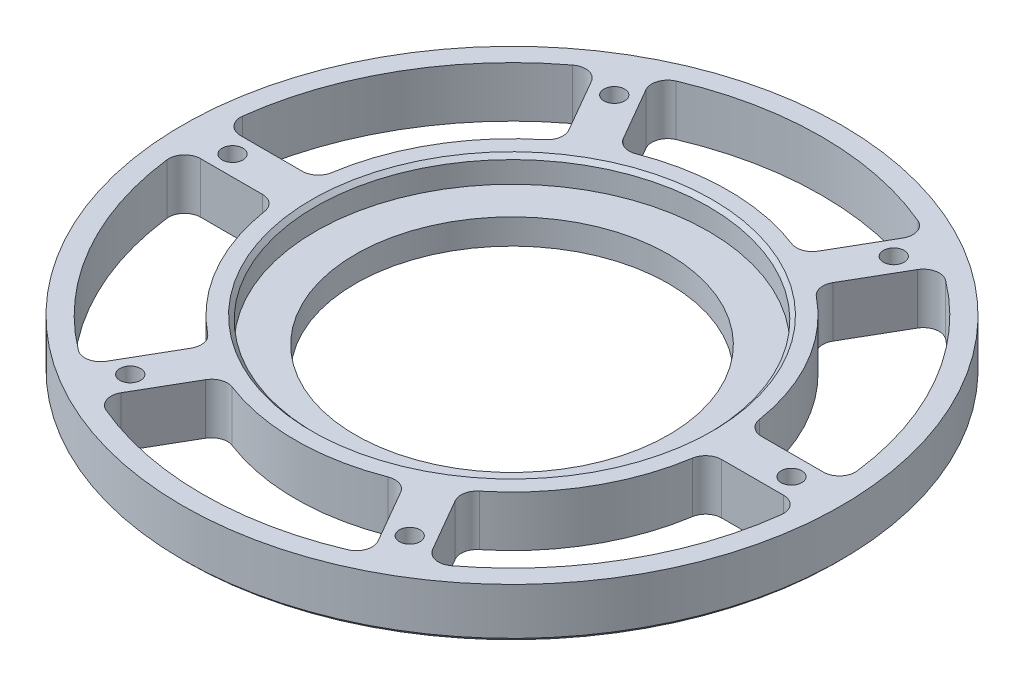
from build123d import *

# Parameters (mm, degrees)
F_6_0_204_DIAMETER_HOLE1_D = 5.1816
CIRPATTERN3_COUNT          = 6
CUT_EXTRUDE1_DEPTH         = 118.43208675655899
FILLET1_R                  = 4
CIRPATTERN4_COUNT          = 6
FILLET1_OF_CIRPATTERN4_R   = 4
CHAMFER1_SIZE              = 1
CHAMFER2_SIZE              = 1


with BuildPart() as part:
    # Sketch2 → Revolve1 (revolve)
    with BuildSketch(Plane(origin=(0, 0, 0), x_dir=(0, 0, -1), z_dir=(1, 0, 0))):
        Polygon((-39.2125, -8.7e-16), (-82.55, -5.31e-15), (-82.55, 12.699999999999994), (-49.2125, 12.699999999999994), (-49.21250000000001, 6.3500000000000005), (-39.21250000000001, 6.349999999999999), align=None)
    revolve(axis=Axis((0, -0.9525000000000071, 0), (0, 1, 0)))

    # #6 (0.204) Diameter Hole1 (through all)
    with Locations(Plane(origin=(0, 12.699999999999994, 0), x_dir=(1, 0, 0), z_dir=(0, 1, 0))):
        with Locations((-35, 60.621778265)):
            f_6_0_204_diameter_hole1 = Hole(F_6_0_204_DIAMETER_HOLE1_D / 2)

    # CirPattern3: #6 (0.204) Diameter Hole1 ×6 about axis
    cirpattern3_axis = Axis((0, -0.9525000000000071, 0), (0, 1, 0))
    for i in range(1, CIRPATTERN3_COUNT):
        add(f_6_0_204_diameter_hole1.rotate(cirpattern3_axis, i * 360 / CIRPATTERN3_COUNT), mode=Mode.SUBTRACT)

    # Sketch8 → Cut-Extrude1 (cut, through all)
    with BuildSketch(Plane(origin=(0, 12.699999999999994, 0), x_dir=(1, 0, 0), z_dir=(0, 1, 0))):
        with BuildLine():
            Line((-34.36419588509058, 69.52053323422601), (-22.660589701137393, 49.249292691841845))
            ThreePointArc((-22.660589701137393, 49.249292691841845), (3.32e-15, 54.212500000000006), (22.660589701137393, 49.249292691841845))
            Line((22.660589701137393, 49.249292691841845), (34.36419588509058, 69.52053323422601))
            ThreePointArc((34.36419588509058, 69.52053323422601), (4.75e-15, 77.55), (-34.36419588509058, 69.52053323422601))
        make_face()
    cut_extrude1 = extrude(amount=-CUT_EXTRUDE1_DEPTH, mode=Mode.SUBTRACT)

    # Fillet1
    fillet1_edges = [part.edges().sort_by_distance(p)[0] for p in [
        (34.36419588509058, 6.349999999999996, -69.52053323422601),
        (22.660589701137397, 6.349999999999996, -49.249292691841845),
        (-34.36419588509059, 6.349999999999996, -69.52053323422601),
        (-22.660589701137393, 6.349999999999996, -49.249292691841845),
    ]]
    fillet(fillet1_edges, radius=FILLET1_R)

    # CirPattern4: Cut-Extrude1 ×6 about axis
    cirpattern4_axis = Axis((0, -0.9525000000000071, 0), (0, 1, 0))
    for i in range(1, CIRPATTERN4_COUNT):
        add(cut_extrude1.rotate(cirpattern4_axis, i * 360 / CIRPATTERN4_COUNT), mode=Mode.SUBTRACT)

    # Fillet1 of CirPattern4
    fillet1_of_cirpattern4_edges = [part.edges().sort_by_distance(p)[0] for p in [
        (-43.024449922934764, 6.349999999999996, -64.52053323422612),
        (-31.320843738981637, 6.349999999999996, -44.24929269184193),
        (-77.38864580802536, 6.349999999999996, -4.99999999999989),
        (-53.981433440119034, 6.349999999999996, -4.999999999999929),
        (-77.38864580802536, 6.349999999999996, 4.999999999999872),
        (-53.981433440119034, 6.349999999999996, 4.999999999999904),
        (-43.02444992293478, 6.349999999999996, 64.52053323422612),
        (-31.32084373898165, 6.349999999999996, 44.249292691841916),
        (-34.36419588509059, 6.349999999999996, 69.52053323422601),
        (-22.660589701137404, 6.349999999999996, 49.249292691841845),
        (34.36419588509058, 6.349999999999996, 69.52053323422601),
        (22.660589701137386, 6.349999999999996, 49.249292691841845),
        (43.02444992293474, 6.349999999999996, 64.52053323422614),
        (31.320843738981612, 6.349999999999996, 44.249292691841944),
        (77.38864580802536, 6.349999999999996, 4.999999999999922),
        (53.98143344011903, 6.349999999999996, 4.999999999999947),
        (77.38864580802536, 6.349999999999996, -4.999999999999897),
        (53.981433440119034, 6.349999999999996, -4.999999999999925),
        (43.024449922934764, 6.349999999999996, -64.52053323422614),
        (31.320843738981637, 6.349999999999996, -44.24929269184193),
    ]]
    fillet(fillet1_of_cirpattern4_edges, radius=FILLET1_OF_CIRPATTERN4_R)

    # Chamfer1
    chamfer1_edges = [part.edges().sort_by_distance(p)[0] for p in [
        (6.03e-15, 12.699999999999994, -49.2125),
    ]]
    chamfer(chamfer1_edges, length=CHAMFER1_SIZE)

    # Chamfer2
    chamfer2_edges = [part.edges().sort_by_distance(p)[0] for p in [
        (4.677e-14, -5.33e-15, -82.55),
    ]]
    chamfer(chamfer2_edges, length=CHAMFER2_SIZE)


solid = part.part
